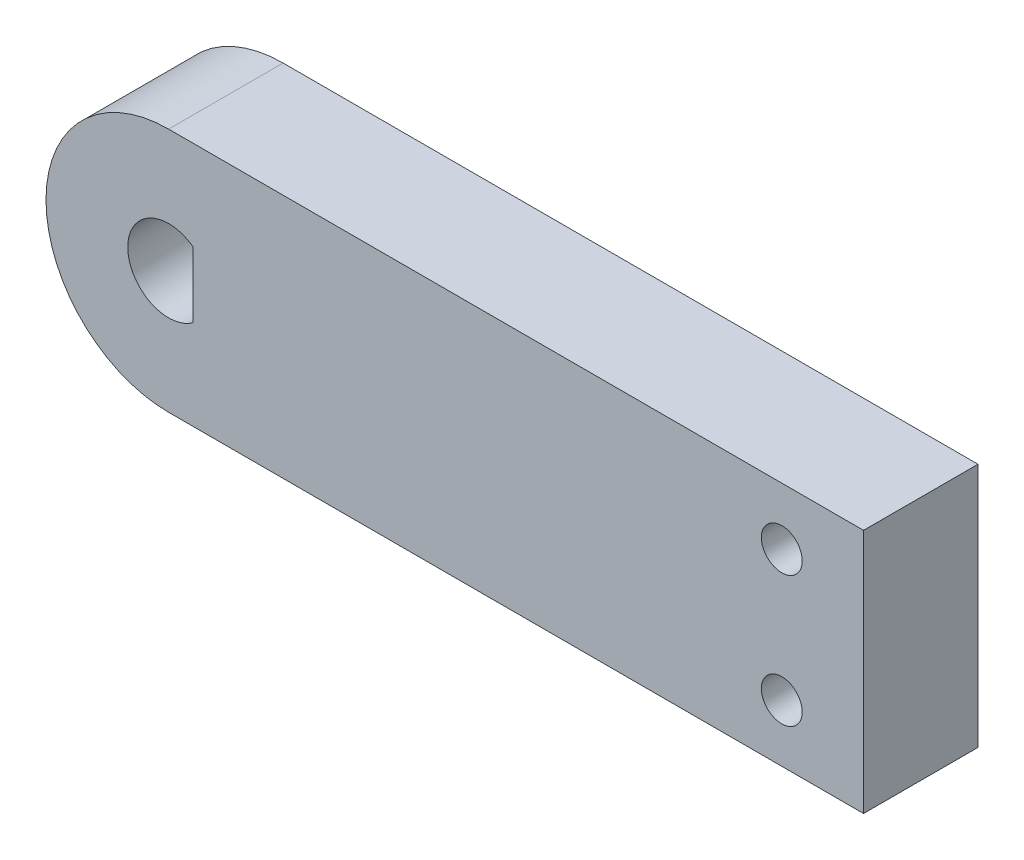
from build123d import *

# Parameters (mm, degrees)
SKETCH1_W               = 63.5
SKETCH1_H               = 19.05
BOSS_EXTRUDE1_DEPTH     = 4.445
SKETCH2_R               = 1.5875
CUT_EXTRUDE1_DEPTH      = 12.7
FILLET1_R               = 9.525
CUT_EXTRUDE2_DEPTH      = 35.319385557
CUT_EXTRUDE2_DEPTH_BACK = 35.319385557


with BuildPart() as part:
    # Sketch1 → Boss-Extrude1 (new, symmetric)
    with BuildSketch(Plane.XY):
        Rectangle(SKETCH1_W, SKETCH1_H)
    extrude(amount=BOSS_EXTRUDE1_DEPTH, both=True)

    # Sketch2 → Cut-Extrude1 (cut)
    with BuildSketch(Plane.XY.offset(4.445)):
        with Locations((25.4, 5.08)):
            Circle(SKETCH2_R)
        with Locations((25.4, -5.08)):
            Circle(SKETCH2_R)
    extrude(amount=-CUT_EXTRUDE1_DEPTH, mode=Mode.SUBTRACT)

    # Fillet1
    fillet1_edges = [part.edges().sort_by_distance(p)[0] for p in [
        (-31.75, -9.525, 0),
        (-31.75, 9.525, 0),
    ]]
    fillet(fillet1_edges, radius=FILLET1_R - 0.0001)  # a hair under: the kernel refuses the full size

    # Sketch3 → Cut-Extrude2 (cut, two sides: drawn at the far end of the back side and taken through both)
    with BuildSketch(Plane.XY.offset(4.445).offset(-CUT_EXTRUDE2_DEPTH_BACK)):
        with BuildLine():
            Line((-20.32, 2.54), (-20.32, -2.54))
            ThreePointArc((-20.32, -2.54), (-25.4, 0), (-20.32, 2.54))
        make_face()
    extrude(amount=CUT_EXTRUDE2_DEPTH + CUT_EXTRUDE2_DEPTH_BACK, mode=Mode.SUBTRACT)


solid = part.part
